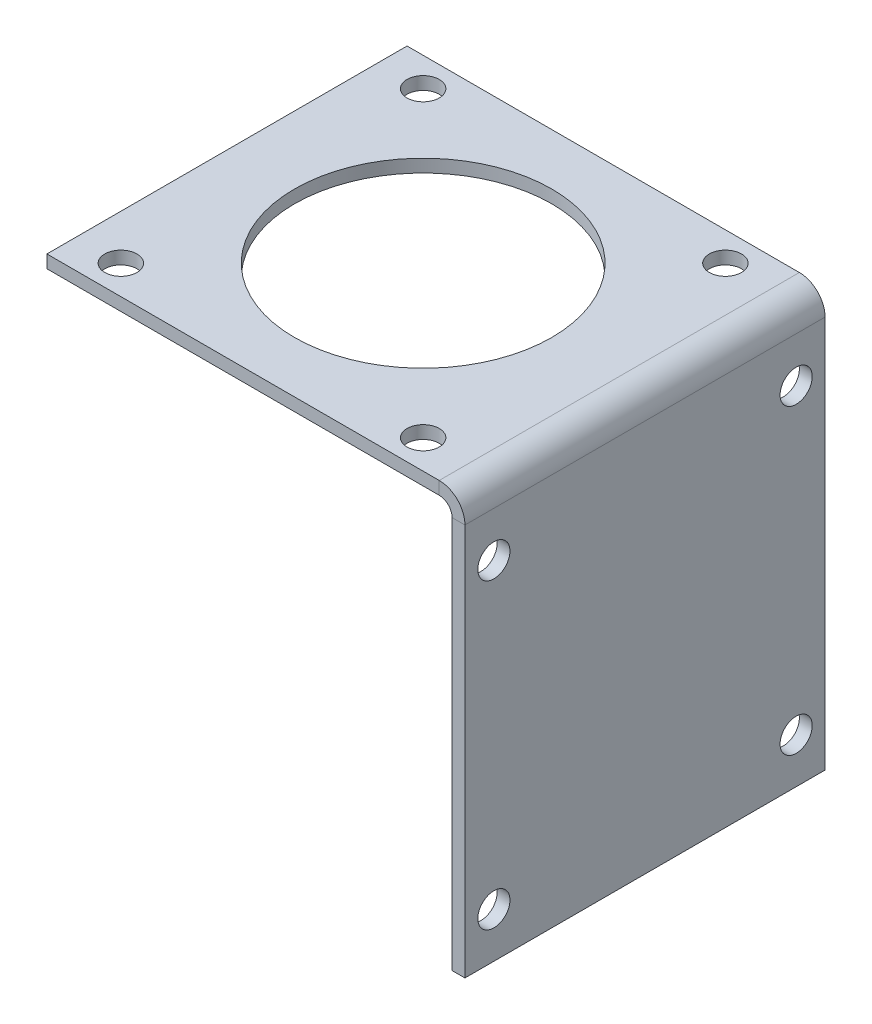
from build123d import *

# Parameters (mm, degrees)
T_LE_DE_BASE_PLI_E1_DEPTH = 56
ENL_V_MAT_EXTRU_1_REACH   = 109.638
ESQUISSE6_R               = 2.5
ESQUISSE6_R_2             = 20
ENL_V_MAT_EXTRU_2_REACH   = 109.638
ESQUISSE7_R               = 2.5


# Sheet-metal steps are written as plain solids
with BuildPart() as part:
    # Esquisse1 → Tôle de base pliée1 (new body)
    with BuildSketch(Plane.XY):
        with BuildLine():
            Line((-65, 0), (-4, 0))
            ThreePointArc((-4, 0), (-1.171572875, -1.171572875), (0, -4))
            Line((0, -4), (0, -65))
            Line((0, -65), (-2, -65))
            Line((-2, -65), (-2, -4))
            ThreePointArc((-2, -4), (-2.585786438, -2.585786438), (-4, -2))
            Line((-4, -2), (-65, -2))
            Line((-65, -2), (-65, 0))
        make_face()
    extrude(amount=T_LE_DE_BASE_PLI_E1_DEPTH)

    # Esquisse6 → Enlèv. mat.-Extru.1 (cut, up to next)
    with BuildSketch(Plane(origin=(0, 0, 0), x_dir=(1, 0, 0), z_dir=(0, 1, 0)), mode=Mode.PRIVATE) as enl_v_mat_extru_1_sk1:
        with Locations(Location((-58, -4.5, 0), (0, 0, 270))):
            Circle(ESQUISSE6_R)
    enl_v_mat_extru_1_tool1 = extrude(enl_v_mat_extru_1_sk1.sketch, amount=-ENL_V_MAT_EXTRU_1_REACH, mode=Mode.PRIVATE) & part.part
    # Esquisse6 → Enlèv. mat.-Extru.1 (cut, up to next)
    with BuildSketch(Plane(origin=(0, 0, 0), x_dir=(1, 0, 0), z_dir=(0, 1, 0)), mode=Mode.PRIVATE) as enl_v_mat_extru_1_sk2:
        with Locations(Location((-11, -4.5, 0), (0, 0, 270))):
            Circle(ESQUISSE6_R)
    enl_v_mat_extru_1_tool2 = extrude(enl_v_mat_extru_1_sk2.sketch, amount=-ENL_V_MAT_EXTRU_1_REACH, mode=Mode.PRIVATE) & part.part
    # Esquisse6 → Enlèv. mat.-Extru.1 (cut, up to next)
    with BuildSketch(Plane(origin=(0, 0, 0), x_dir=(1, 0, 0), z_dir=(0, 1, 0)), mode=Mode.PRIVATE) as enl_v_mat_extru_1_sk3:
        with Locations(Location((-11, -51.5, 0), (0, 0, 270))):
            Circle(ESQUISSE6_R)
    enl_v_mat_extru_1_tool3 = extrude(enl_v_mat_extru_1_sk3.sketch, amount=-ENL_V_MAT_EXTRU_1_REACH, mode=Mode.PRIVATE) & part.part
    # Esquisse6 → Enlèv. mat.-Extru.1 (cut, up to next)
    with BuildSketch(Plane(origin=(0, 0, 0), x_dir=(1, 0, 0), z_dir=(0, 1, 0)), mode=Mode.PRIVATE) as enl_v_mat_extru_1_sk4:
        with Locations(Location((-58, -51.5, 0), (0, 0, 270))):
            Circle(ESQUISSE6_R)
    enl_v_mat_extru_1_tool4 = extrude(enl_v_mat_extru_1_sk4.sketch, amount=-ENL_V_MAT_EXTRU_1_REACH, mode=Mode.PRIVATE) & part.part
    # Esquisse6 → Enlèv. mat.-Extru.1 (cut, up to next)
    with BuildSketch(Plane(origin=(0, 0, 0), x_dir=(1, 0, 0), z_dir=(0, 1, 0)), mode=Mode.PRIVATE) as enl_v_mat_extru_1_sk5:
        with Locations(Location((-34.5, -28, 0), (0, 0, 270))):
            Circle(ESQUISSE6_R_2)
    enl_v_mat_extru_1_tool5 = extrude(enl_v_mat_extru_1_sk5.sketch, amount=-ENL_V_MAT_EXTRU_1_REACH, mode=Mode.PRIVATE) & part.part
    add(enl_v_mat_extru_1_tool1.solids().sort_by_distance((-58, 0, 4.5))[0], mode=Mode.SUBTRACT)
    add(enl_v_mat_extru_1_tool2.solids().sort_by_distance((-11, 0, 4.5))[0], mode=Mode.SUBTRACT)
    add(enl_v_mat_extru_1_tool3.solids().sort_by_distance((-11, 0, 51.5))[0], mode=Mode.SUBTRACT)
    add(enl_v_mat_extru_1_tool4.solids().sort_by_distance((-58, 0, 51.5))[0], mode=Mode.SUBTRACT)
    add(enl_v_mat_extru_1_tool5.solids().sort_by_distance((-34.5, 0, 28))[0], mode=Mode.SUBTRACT)

    # Esquisse7 → Enlèv. mat.-Extru.2 (cut, up to next)
    with BuildSketch(Plane(origin=(0, 0, 0), x_dir=(0, 0, -1), z_dir=(1, 0, 0)), mode=Mode.PRIVATE) as enl_v_mat_extru_2_sk1:
        with Locations(Location((-4.5, -11, 0), (0, 0, 90))):
            Circle(ESQUISSE7_R)
    enl_v_mat_extru_2_tool1 = extrude(enl_v_mat_extru_2_sk1.sketch, amount=-ENL_V_MAT_EXTRU_2_REACH, mode=Mode.PRIVATE) & part.part
    # Esquisse7 → Enlèv. mat.-Extru.2 (cut, up to next)
    with BuildSketch(Plane(origin=(0, 0, 0), x_dir=(0, 0, -1), z_dir=(1, 0, 0)), mode=Mode.PRIVATE) as enl_v_mat_extru_2_sk2:
        with Locations(Location((-4.5, -58, 0), (0, 0, 90))):
            Circle(ESQUISSE7_R)
    enl_v_mat_extru_2_tool2 = extrude(enl_v_mat_extru_2_sk2.sketch, amount=-ENL_V_MAT_EXTRU_2_REACH, mode=Mode.PRIVATE) & part.part
    # Esquisse7 → Enlèv. mat.-Extru.2 (cut, up to next)
    with BuildSketch(Plane(origin=(0, 0, 0), x_dir=(0, 0, -1), z_dir=(1, 0, 0)), mode=Mode.PRIVATE) as enl_v_mat_extru_2_sk3:
        with Locations(Location((-51.5, -58, 0), (0, 0, 90))):
            Circle(ESQUISSE7_R)
    enl_v_mat_extru_2_tool3 = extrude(enl_v_mat_extru_2_sk3.sketch, amount=-ENL_V_MAT_EXTRU_2_REACH, mode=Mode.PRIVATE) & part.part
    # Esquisse7 → Enlèv. mat.-Extru.2 (cut, up to next)
    with BuildSketch(Plane(origin=(0, 0, 0), x_dir=(0, 0, -1), z_dir=(1, 0, 0)), mode=Mode.PRIVATE) as enl_v_mat_extru_2_sk4:
        with Locations(Location((-51.5, -11, 0), (0, 0, 90))):
            Circle(ESQUISSE7_R)
    enl_v_mat_extru_2_tool4 = extrude(enl_v_mat_extru_2_sk4.sketch, amount=-ENL_V_MAT_EXTRU_2_REACH, mode=Mode.PRIVATE) & part.part
    add(enl_v_mat_extru_2_tool1.solids().sort_by_distance((0, -11, 4.5))[0], mode=Mode.SUBTRACT)
    add(enl_v_mat_extru_2_tool2.solids().sort_by_distance((0, -58, 4.5))[0], mode=Mode.SUBTRACT)
    add(enl_v_mat_extru_2_tool3.solids().sort_by_distance((0, -58, 51.5))[0], mode=Mode.SUBTRACT)
    add(enl_v_mat_extru_2_tool4.solids().sort_by_distance((0, -11, 51.5))[0], mode=Mode.SUBTRACT)


solid = part.part
